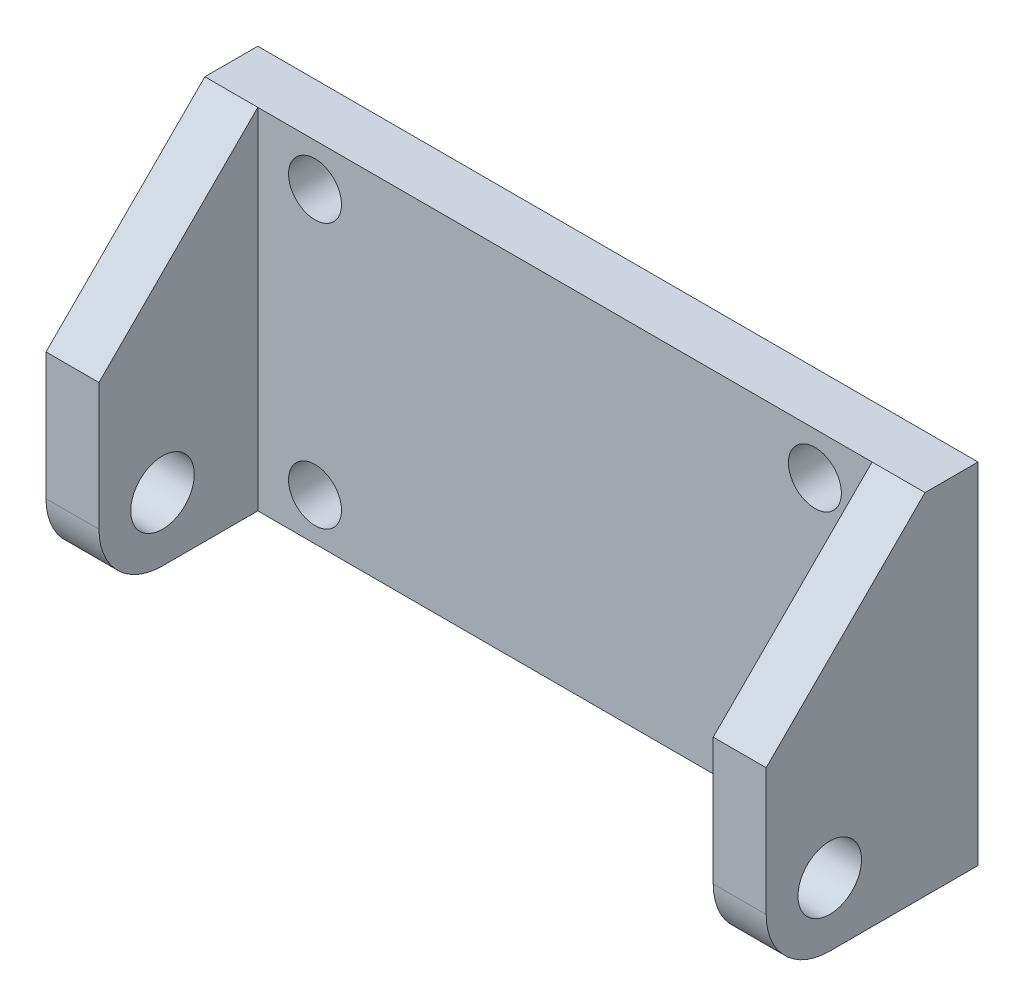
from build123d import *

# Parameters (mm, degrees)
SKETCH1_W           = 34
SKETCH1_H           = 16.5
SKETCH1_R           = 1.25
BOSS_EXTRUDE1_DEPTH = 2.5
SKETCH2_W           = 2.5
SKETCH2_H           = 16.5
BOSS_EXTRUDE2_DEPTH = 7.5
CHAMFER1_SIZE       = 7.5
FILLET1_R           = 3
SKETCH3_R           = 1.5
CUT_EXTRUDE1_DEPTH  = 38.542526662


with BuildPart() as part:
    # Sketch1 → Boss-Extrude1 (new body)
    with BuildSketch(Plane.XY):
        with Locations((0.621428571, 4.137142857)):
            Rectangle(SKETCH1_W, SKETCH1_H)
        with Locations((-11.178571429, -2.112857143)):
            Circle(SKETCH1_R, mode=Mode.SUBTRACT)
        with Locations((12.421428571, -2.112857143)):
            Circle(SKETCH1_R, mode=Mode.SUBTRACT)
        with Locations((12.421428571, 10.387142857)):
            Circle(SKETCH1_R, mode=Mode.SUBTRACT)
        with Locations((-11.178571429, 10.387142857)):
            Circle(SKETCH1_R, mode=Mode.SUBTRACT)
    extrude(amount=BOSS_EXTRUDE1_DEPTH)

    # Sketch2 → Boss-Extrude2 (add)
    with BuildSketch(Plane.XY.offset(2.5)):
        with Locations((-15.128571429, 4.137142857)):
            Rectangle(SKETCH2_W, SKETCH2_H)
        with Locations((16.371428571, 4.137142857)):
            Rectangle(SKETCH2_W, SKETCH2_H)
    extrude(amount=BOSS_EXTRUDE2_DEPTH)

    # Chamfer1
    chamfer1_edges = [part.edges().sort_by_distance(p)[0] for p in [
        (16.371428571, 12.387142857, 10),
        (-15.128571429, 12.387142857, 10),
    ]]
    chamfer(chamfer1_edges, length=CHAMFER1_SIZE)

    # Fillet1
    fillet1_edges = [part.edges().sort_by_distance(p)[0] for p in [
        (16.371428571, -4.112857143, 10),
        (-15.128571429, -4.112857143, 10),
    ]]
    fillet(fillet1_edges, radius=FILLET1_R)

    # Sketch3 → Cut-Extrude1 (cut, through all)
    with BuildSketch(Plane(origin=(17.621428571, 0, 0), x_dir=(0, 0, -1), z_dir=(1, 0, 0))):
        with Locations((-7, -1.112857143)):
            Circle(SKETCH3_R)
    extrude(amount=-CUT_EXTRUDE1_DEPTH, mode=Mode.SUBTRACT)


solid = part.part
